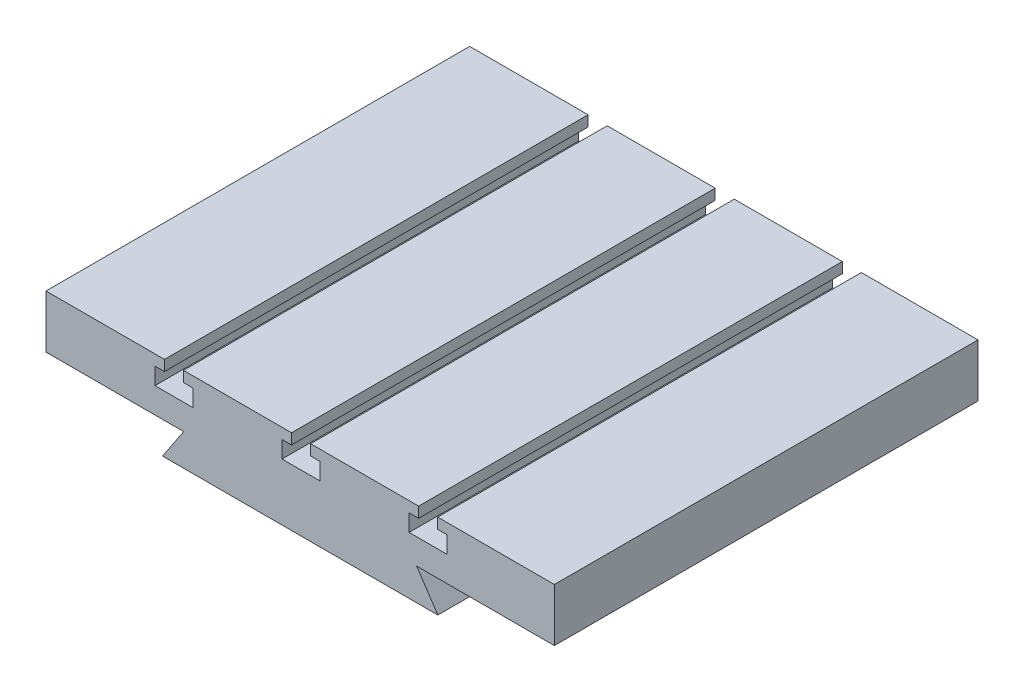
from build123d import *

# Parameters (mm, degrees)
EXTRUDE_1_DEPTH     = 200
CUT_EXTRUDE_1_DEPTH = 237.643191324


with BuildPart() as part:
    # Эскиз1 → Бобышка-Вытянуть1 (new body)
    with BuildSketch(Plane.XY):
        Polygon((0, 0), (65, 0), (55, 15), (120, 15), (120, 40), (0, 40), (-120, 40), (-120, 15), (-55, 15), (-65, 0), align=None)
    extrude(amount=EXTRUDE_1_DEPTH)

    # Эскиз2 → Вырез-Вытянуть1 (cut, through all)
    with BuildSketch(Plane.XY.offset(200)):
        Polygon((-8.573821021, 27), (9.426178979, 27), (9.426178979, 35), (4.926178979, 35), (4.926178979, 40), (-4.073821021, 40), (-4.073821021, 35), (-8.573821021, 35), align=None)
        Polygon((51.426178979, 27), (69.426178979, 27), (69.426178979, 35), (64.926178979, 35), (64.926178979, 40), (55.926178979, 40), (55.926178979, 35), (51.426178979, 35), align=None)
        Polygon((-68.573821021, 27), (-50.573821021, 27), (-50.573821021, 35), (-55.073821021, 35), (-55.073821021, 40), (-64.073821021, 40), (-64.073821021, 35), (-68.573821021, 35), align=None)
    extrude(amount=-CUT_EXTRUDE_1_DEPTH, mode=Mode.SUBTRACT)


solid = part.part
